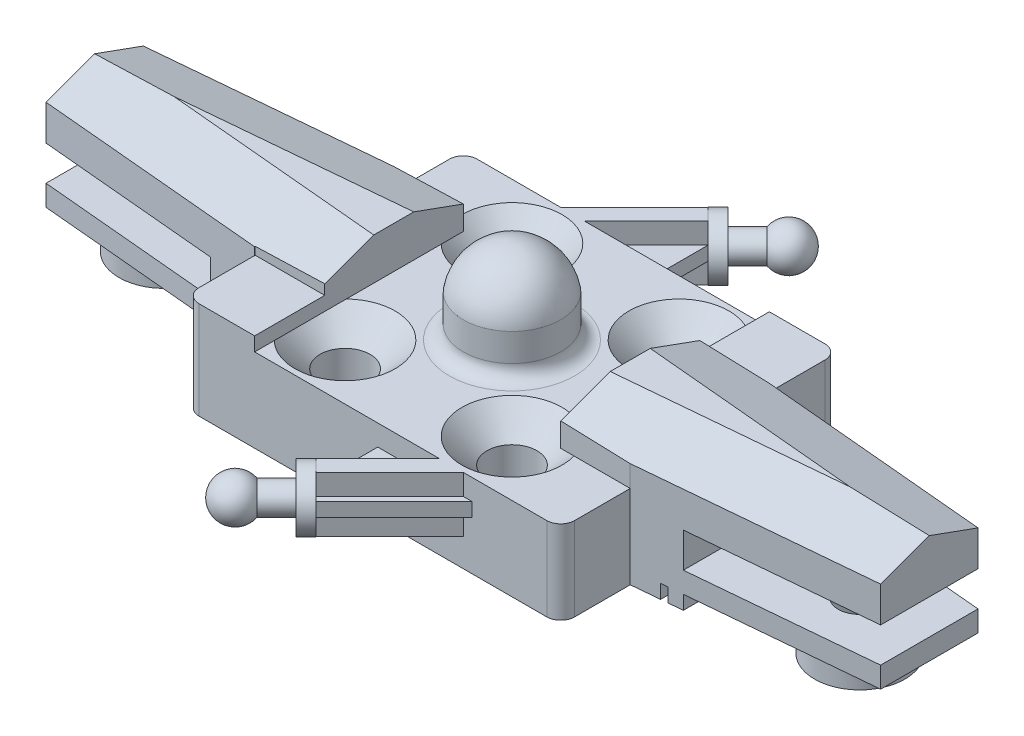
from build123d import *

# Parameters (mm, degrees)
SKETCH2_W                                    = 30
SKETCH2_H                                    = 10
SKETCH2_R                                    = 1.5
BOSS_EXTRUDE1_DEPTH                          = 4.5
CUT_EXTRUDE1_START                           = -1.5
SKETCH3_W                                    = 2.5
SKETCH3_H                                    = 2.5
SKETCH3_R                                    = 1.75
SKETCH3_R_2                                  = 1.5
CUT_EXTRUDE1_DEPTH                           = 1.5
CUT_EXTRUDE2_DEPTH                           = 17.439282223
SKETCH5_W                                    = 2.5
SKETCH5_H                                    = 2.519100352
SKETCH5_H_2                                  = 2.5
CUT_EXTRUDE3_DEPTH                           = 1
SKETCH6_W                                    = 0.25
SKETCH6_H                                    = 0.5
SKETCH6_W_2                                  = 6.5
SKETCH6_H_2                                  = 1.25
CUT_EXTRUDE4_DEPTH                           = 9.5
SKETCH7_R                                    = 1.625
SKETCH7_R_2                                  = 1
SKETCH7_R_3                                  = 0.5
BOSS_EXTRUDE2_DEPTH                          = 1
CHAMFER1_SIZE                                = 0.727940469
CHAMFER1_SIZE_2                              = 2
CSK_FOR_M1_6_COUNTERSUNK_FLAT_HEAD_S_2_COUNT = 2
CSK_FOR_M1_6_COUNTERSUNK_FLAT_HEAD_S_2_PITCH = 6
BOSS_EXTRUDE3_DEPTH                          = 2
BOSS_EXTRUDE4_START                          = -0.75
BOSS_EXTRUDE4_DEPTH                          = 0.5
SKETCH34_R                                   = 1.75
BOSS_EXTRUDE5_DEPTH                          = 1.5
CIRPATTERN1_COUNT                            = 2
CUT_EXTRUDE5_DEPTH                           = 2
SKETCH37_R                                   = 0.5
CUT_EXTRUDE6_DEPTH                           = 6
FILLET1_R                                    = 0.5
CHAMFER2_SIZE                                = 0.5
FILLET2_R                                    = 0.5


# Read off the part's stored shape, not the designer's step: Dome1, Dome3
# Some blends are built 0.0001 mm under size
with BuildPart() as part:
    # Sketch2 → Boss-Extrude1 (new body)
    with BuildSketch(Plane(origin=(0, 0, 0), x_dir=(1, 0, 0), z_dir=(0, 1, 0))):
        Rectangle(SKETCH2_W, SKETCH2_H)
        with Locations(Location((0, 0, 0), (0, 0, 270))):
            Circle(SKETCH2_R, mode=Mode.SUBTRACT)
    extrude(amount=BOSS_EXTRUDE1_DEPTH)

    # Sketch3 → Cut-Extrude1 (cut)
    # profile 1 of 5: a face of its own
    with BuildSketch(Plane(origin=(0, 4.5, 0), x_dir=(1, 0, 0), z_dir=(0, 1, 0)).offset(CUT_EXTRUDE1_START)):
        with Locations((-5.5, 3.75)):
            Rectangle(SKETCH3_W, SKETCH3_H)
    # profile 2 of 5: a face of its own
    with BuildSketch(Plane(origin=(0, 4.5, 0), x_dir=(1, 0, 0), z_dir=(0, 1, 0)).offset(CUT_EXTRUDE1_START)):
        Polygon((4.25, 5), (-4.25, 5), (-4.25, 2.5), (-4.25, -5), (4.25, -5), (4.25, -2.5), align=None)
        with Locations(Location((0, 0, 0), (0, 0, 270))):
            Circle(SKETCH3_R, mode=Mode.SUBTRACT)
    # profile 3 of 5: a face of its own
    with BuildSketch(Plane(origin=(0, 4.5, 0), x_dir=(1, 0, 0), z_dir=(0, 1, 0)).offset(CUT_EXTRUDE1_START)):
        with Locations((5.5, -3.75)):
            Rectangle(SKETCH3_W, SKETCH3_H)
    # profile 4 of 5: a face of its own
    with BuildSketch(Plane(origin=(0, 4.5, 0), x_dir=(1, 0, 0), z_dir=(0, 1, 0)).offset(CUT_EXTRUDE1_START)):
        with Locations(Location((0, 0, 0), (0, 0, 270))):
            Circle(SKETCH3_R_2)
    # profile 5 of 5: a face of its own
    with BuildSketch(Plane(origin=(0, 4.5, 0), x_dir=(1, 0, 0), z_dir=(0, 1, 0)).offset(CUT_EXTRUDE1_START)):
        with Locations(Location((0, 0, 0), (0, 0, 270))):
            Circle(SKETCH3_R_2)
    extrude(amount=CUT_EXTRUDE1_DEPTH, mode=Mode.SUBTRACT)

    # Sketch4 → Cut-Extrude2 (cut, through all)
    with BuildSketch(Plane(origin=(0, 4.5, 0), x_dir=(1, 0, 0), z_dir=(0, 1, 0))):
        Polygon((-6.75, 5), (-6.75, 2.5), (-15, 1.75), (-15, 5), align=None)
        Polygon((6.75, -5), (6.75, -2.5), (15, -1.75), (15, -5), align=None)
        Polygon((15, 5), (6.75, 5), (6.75, 2.5), (15, 1.75), align=None)
        Polygon((-15, -1.75), (-15, -5), (-6.75, -5), (-6.75, -2.5), align=None)
    extrude(amount=-CUT_EXTRUDE2_DEPTH, mode=Mode.SUBTRACT)

    # Sketch5 → Cut-Extrude3 (cut)
    with BuildSketch(Plane(origin=(0, 4.5, 0), x_dir=(1, 0, 0), z_dir=(0, 1, 0))):
        with Locations((-5.5, -3.740449824)):
            Rectangle(SKETCH5_W, SKETCH5_H)
        with Locations((5.5, 3.75)):
            Rectangle(SKETCH5_W, SKETCH5_H_2)
    extrude(amount=-CUT_EXTRUDE3_DEPTH, mode=Mode.SUBTRACT)

    # Sketch6 → Cut-Extrude4 (cut, symmetric)
    with BuildSketch(Plane.XY):
        with Locations((-7.875, 0.25)):
            Rectangle(SKETCH6_W, SKETCH6_H)
        with Locations((-11.75, 0.25)):
            Rectangle(SKETCH6_W_2, SKETCH6_H)
        with Locations((-11.75, 1.875)):
            Rectangle(SKETCH6_W_2, SKETCH6_H_2)
    cut_extrude4 = extrude(amount=CUT_EXTRUDE4_DEPTH, both=True, mode=Mode.SUBTRACT)

    # Sketch7 → Boss-Extrude2 (add)
    # profile 1 of 3: a face of its own
    with BuildSketch(Plane.XZ.offset(-0.5)):
        with Locations(Location((-12.5, 0, 0), (0, 0, 180))):
            Circle(SKETCH7_R)
    # profile 2 of 3: a face of its own
    with BuildSketch(Plane.XZ.offset(-0.5)):
        with Locations(Location((-3, 3, 0), (0, 0, 90))):
            Circle(SKETCH7_R_2)
        with Locations(Location((-3, 3, 0), (0, 0, 90))):
            Circle(SKETCH7_R_3, mode=Mode.SUBTRACT)
    # profile 3 of 3: a face of its own
    with BuildSketch(Plane.XZ.offset(-0.5)):
        with Locations(Location((-3, -3, 0), (0, 0, 90))):
            Circle(SKETCH7_R_2)
        with Locations(Location((-3, -3, 0), (0, 0, 90))):
            Circle(SKETCH7_R_3, mode=Mode.SUBTRACT)
    boss_extrude2 = extrude(amount=BOSS_EXTRUDE2_DEPTH)

    # Chamfer1
    # the kernel refuses this chamfer: 2, 0.727940469 mm, written as the material it takes off along each edge
    with BuildSketch(Plane(origin=(-1.582918179, 4.5, 2.969734711), x_dir=(-0.008966741974113306, -0.9950833631817487, 0.0986341617152475), z_dir=(-0.9958932064677041, 0, -0.09053574604251752))) as chamfer1_piece_1_section:
        Polygon((CHAMFER1_SIZE * 0.995083362543, -CHAMFER1_SIZE * 0.0990409021884), (-CHAMFER1_SIZE_2 * 0.099040902252, -CHAMFER1_SIZE_2 * 0.995083363182), (0, 0), align=None)
    chamfer1_piece_1 = extrude(amount=18.660799693, mode=Mode.PRIVATE)
    chamfer1_piece_1 = split(chamfer1_piece_1, bisect_by=Plane(origin=(-4.25, 4.272837188, 1.854201231), z_dir=(-1, 0, 0)), keep=Keep.TOP, mode=Mode.PRIVATE)
    add(chamfer1_piece_1, mode=Mode.SUBTRACT)
    with BuildSketch(Plane(origin=(-1.582918179, 4.5, -2.969734711), x_dir=(-0.00896674197411342, -0.9950833631817487, -0.09863416171524762), z_dir=(-0.9958932064677039, 0, 0.09053574604251854))) as chamfer1_piece_2_section:
        Polygon((CHAMFER1_SIZE * 0.995083362543, CHAMFER1_SIZE * 0.0990409021884), (-CHAMFER1_SIZE_2 * 0.099040902252, CHAMFER1_SIZE_2 * 0.995083363182), (0, 0), align=None)
    chamfer1_piece_2 = extrude(amount=18.660799693, mode=Mode.PRIVATE)
    chamfer1_piece_2 = split(chamfer1_piece_2, bisect_by=Plane(origin=(-4.25, 4.260155849, -1.543047627), z_dir=(-1, 0, 0)), keep=Keep.TOP, mode=Mode.PRIVATE)
    add(chamfer1_piece_2, mode=Mode.SUBTRACT)
    with BuildSketch(Plane(origin=(1.582918179, 4.5, 2.969734711), x_dir=(0.008966741974113313, -0.9950833631817487, 0.0986341617152475), z_dir=(0.9958932064677041, 0, -0.09053574604251757))) as chamfer1_piece_3_section:
        Polygon((CHAMFER1_SIZE * 0.995083362543, CHAMFER1_SIZE * 0.0990409021884), (-CHAMFER1_SIZE_2 * 0.099040902252, CHAMFER1_SIZE_2 * 0.995083363182), (0, 0), align=None)
    chamfer1_piece_3 = extrude(amount=18.660799693, mode=Mode.PRIVATE)
    chamfer1_piece_3 = split(chamfer1_piece_3, bisect_by=Plane(origin=(4.25, 4.260155849, 1.543047627), z_dir=(1, 0, 0)), keep=Keep.TOP, mode=Mode.PRIVATE)
    add(chamfer1_piece_3, mode=Mode.SUBTRACT)
    with BuildSketch(Plane(origin=(1.582918179, 4.5, -2.969734711), x_dir=(0.00896674197411333, -0.9950833631817487, -0.09863416171524761), z_dir=(0.995893206467704, 0, 0.09053574604251764))) as chamfer1_piece_4_section:
        Polygon((CHAMFER1_SIZE * 0.995083362543, -CHAMFER1_SIZE * 0.0990409021884), (-CHAMFER1_SIZE_2 * 0.099040902252, -CHAMFER1_SIZE_2 * 0.995083363182), (0, 0), align=None)
    chamfer1_piece_4 = extrude(amount=18.660799693, mode=Mode.PRIVATE)
    chamfer1_piece_4 = split(chamfer1_piece_4, bisect_by=Plane(origin=(4.25, 4.260155849, -1.543047627), z_dir=(1, 0, 0)), keep=Keep.TOP, mode=Mode.PRIVATE)
    add(chamfer1_piece_4, mode=Mode.SUBTRACT)

    # Sketch9 → Ø1.55 (1.55) Diameter Hole2 (revolve, cut)
    with BuildSketch(Plane(origin=(-12.5, -0.5, 0), x_dir=(0, 0, -1), z_dir=(1, 0, 0))):
        Polygon((0, 0), (0, 3), (0.775, 2.53433302), (0.775, 0), align=None)
    f_1_55_1_55_diameter_hole2 = revolve(axis=Axis((-12.5, -6.85, 0), (0, 1, 0)), mode=Mode.SUBTRACT)

    # Sketch30 → CSK for M1.6 Countersunk Flat Head Screw9 (revolve, cut)
    with BuildSketch(Plane(origin=(-3, 3, 3), x_dir=(0, 0, 1), z_dir=(1, 0, 0))):
        Polygon((0, 0), (0, 3.5), (0.9, 3.5), (0.9, 0.9), (1.8, 0), align=None)
    csk_for_m1_6_countersunk_flat_head_screw = revolve(axis=Axis((-3, 9.35, 3), (0, -1, 0)), mode=Mode.SUBTRACT)

    # CSK for M1.6 Countersunk Flat Head S 2: CSK for M1.6 Countersunk Flat Head Screw9 ×2
    with Locations(*[(0, 0, -i * CSK_FOR_M1_6_COUNTERSUNK_FLAT_HEAD_S_2_PITCH) for i in range(1, CSK_FOR_M1_6_COUNTERSUNK_FLAT_HEAD_S_2_COUNT)]):
        add(csk_for_m1_6_countersunk_flat_head_screw, mode=Mode.SUBTRACT)

    # Sketch31 → Boss-Extrude3 (add)
    with BuildSketch(Plane(origin=(0, 3, 0), x_dir=(1, 0, 0), z_dir=(0, 1, 0))):
        Polygon((-3.25, 5), (-0.598349571, 7.651650429), (-0.174085502, 7.227386361), (-2.401471863, 5), align=None)
    boss_extrude3 = extrude(amount=-BOSS_EXTRUDE3_DEPTH)

    # Sketch32 → Boss-Extrude4 (add)
    with BuildSketch(Plane(origin=(0, 3, 0), x_dir=(1, 0, 0), z_dir=(0, 1, 0)).offset(BOSS_EXTRUDE4_START)):
        Polygon((-0.174085502, 7.227386361), (-0.174085502, 5), (-3.561126984, 5), (-0.753913062, 7.807213921), align=None)
    boss_extrude4 = extrude(amount=-BOSS_EXTRUDE4_DEPTH)

    # Sketch33 → Revolve1 (revolve)
    with BuildSketch(Plane(origin=(0, 2, 0), x_dir=(1, 0, 0), z_dir=(0, 1, 0))):
        with BuildLine():
            Line((-0.386217536, 7.439518395), (1.593681451, 9.419417382))
            ThreePointArc((1.593681451, 9.419417382), (1.748004562, 8.582901079), (1.021620048, 8.140249198))
            Line((1.021620048, 8.140249198), (0.320889245, 7.439518395))
            Line((0.320889245, 7.439518395), (0.674442636, 7.085965005))
            Line((0.674442636, 7.085965005), (0.320889245, 6.732411614))
            Line((0.320889245, 6.732411614), (-0.386217536, 7.439518395))
        make_face()
    revolve1 = revolve(axis=Axis((-0.386217536, 2, -7.439518395), (0.7071067811865476, 0, -0.7071067811865476)))

    # Sketch34 → Boss-Extrude5 (add)
    with BuildSketch(Plane(origin=(0, 3, 0), x_dir=(1, 0, 0), z_dir=(0, 1, 0))):
        with Locations(Location((0, 0, 0), (0, 0, 270))):
            Circle(SKETCH34_R)
    extrude(amount=BOSS_EXTRUDE5_DEPTH)

    # Dome1 outline → Dome1 (revolve)
    with BuildSketch(Plane.XY):
        with BuildLine():
            Line((0, 4.5), (1.75, 4.499999998))
            ThreePointArc((1.75, 4.499999998), (1.152443058, 5.573683566), (0, 6))
            Line((0, 6), (0, 4.5))
        make_face()
    revolve(axis=Axis((0, 0, 0), (0, 1, 0)))

    # Mirror1: Cut-Extrude4, Boss-Extrude2, Ø1.55 (1.55) Diameter Hole2, CSK for M1.6 Countersunk Flat Head Screw9 across plane
    add(cut_extrude4.mirror(Plane(origin=(0, 0, 0), x_dir=(0, 0, 1), z_dir=(1, 0, 0))), mode=Mode.SUBTRACT)
    add(boss_extrude2.mirror(Plane(origin=(0, 0, 0), x_dir=(0, 0, 1), z_dir=(1, 0, 0))))
    add(f_1_55_1_55_diameter_hole2.mirror(Plane(origin=(0, 0, 0), x_dir=(0, 0, 1), z_dir=(1, 0, 0))), mode=Mode.SUBTRACT)
    add(csk_for_m1_6_countersunk_flat_head_screw.mirror(Plane(origin=(0, 0, 0), x_dir=(0, 0, 1), z_dir=(1, 0, 0))), mode=Mode.SUBTRACT)

    # Mirror1 copy 1 sketch → Mirror1 copy 1 (revolve, cut)
    with BuildSketch(Plane(origin=(3, 3, -3), x_dir=(0, 0, 1), z_dir=(-1, 0, 0))):
        Polygon((0, 0), (0, -3.5), (0.9, -3.5), (0.9, -0.9), (1.8, 0), align=None)
    revolve(axis=Axis((3, 9.35, -3), (0, 1, 0)), mode=Mode.SUBTRACT)

    # CirPattern1: Boss-Extrude3, Boss-Extrude4, Revolve1 ×2 about axis
    cirpattern1_axis = Axis((0, 0, 0), (0, 1, 0))
    add([boss_extrude3.rotate(cirpattern1_axis, i * 360 / CIRPATTERN1_COUNT) for i in range(1, CIRPATTERN1_COUNT)])
    add([boss_extrude4.rotate(cirpattern1_axis, i * 360 / CIRPATTERN1_COUNT) for i in range(1, CIRPATTERN1_COUNT)])
    add([revolve1.rotate(cirpattern1_axis, i * 360 / CIRPATTERN1_COUNT) for i in range(1, CIRPATTERN1_COUNT)])

    # Dome3 outline → Dome3 (revolve, cut)
    with BuildSketch(Plane.XY):
        with BuildLine():
            Line((0, 3), (1.500000001, 2.999999998))
            ThreePointArc((1.500000001, 2.999999998), (0.90138782, 3.727081728), (0, 4))
            Line((0, 4), (0, 3))
        make_face()
    revolve(axis=Axis((0, 0, 0), (0, 1, 0)), mode=Mode.SUBTRACT)

    # Sketch36 → Cut-Extrude5 (cut)
    with BuildSketch(Plane.XZ):
        with BuildLine():
            Line((2, 1.5), (2, -1.5))
            ThreePointArc((2, -1.5), (0, -3.5), (-2, -1.5))
            Line((-2, -1.5), (-2, 1.5))
            ThreePointArc((-2, 1.5), (0, 3.5), (2, 1.5))
        make_face()
    extrude(amount=-CUT_EXTRUDE5_DEPTH, mode=Mode.SUBTRACT)

    # Sketch37 → Cut-Extrude6 (cut, symmetric)
    with BuildSketch(Plane(origin=(0, 0, 0), x_dir=(0, 0, -1), z_dir=(1, 0, 0))):
        with Locations((0, 1)):
            Circle(SKETCH37_R)
    extrude(amount=CUT_EXTRUDE6_DEPTH, both=True, mode=Mode.SUBTRACT)

    # Fillet1
    fillet1_edges = [part.edges().sort_by_distance(p)[0] for p in [
        (0, 3, -1.75),
    ]]
    fillet(fillet1_edges, radius=FILLET1_R)

    # Chamfer2
    chamfer2_edges = [part.edges().sort_by_distance(p)[0] for p in [
        (0, 2, -1.5),
    ]]
    chamfer(chamfer2_edges, length=CHAMFER2_SIZE - 0.0001)  # a hair under: the kernel refuses the full size

    # Fillet2
    fillet2_edges = [part.edges().sort_by_distance(p)[0] for p in [
        (-6.75, 1.75, 5),
        (6.75, 1.5, 5),
        (6.75, 1.75, -5),
        (-6.75, 1.5, -5),
    ]]
    fillet(fillet2_edges, radius=FILLET2_R)


solid = part.part
